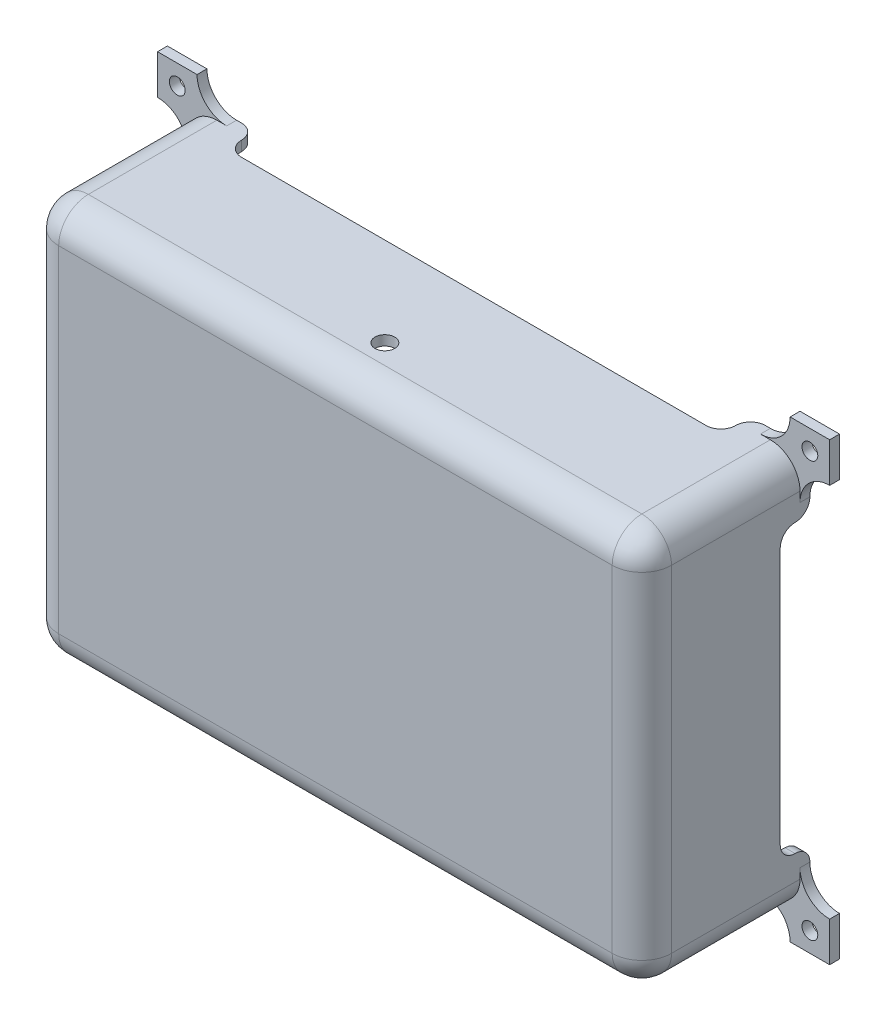
from build123d import *

# Parameters (mm, degrees)
SKETCH2_R           = 4
SKETCH2_W           = 300
SKETCH2_H           = 190
BOSS_EXTRUDE1_DEPTH = 5
SKETCH3_W           = 310
SKETCH3_H           = 200
SKETCH3_W_2         = 300
SKETCH3_H_2         = 190
BOSS_EXTRUDE2_DEPTH = 75
SKETCH4_W           = 310
SKETCH4_H           = 200
BOSS_EXTRUDE3_DEPTH = 5
FILLET2_R           = 15
FILLET3_R           = 15
FILLET4_R           = 15
SKETCH5_R           = 5
CUT_EXTRUDE1_DEPTH  = 5
SKETCH6_W           = 250
SKETCH6_H           = 30
CUT_EXTRUDE2_DEPTH  = 400
SKETCH7_W           = 30
SKETCH7_H           = 145
CUT_EXTRUDE3_DEPTH  = 400
FILLET5_START       = -155
FILLET5_DEPTH       = 5
FILLET5_START_2     = 150
FILLET5_2_DEPTH     = 5
FILLET5_START_3     = -100
FILLET5_3_DEPTH     = 5
FILLET5_START_4     = 95
FILLET5_4_DEPTH     = 5
FILLET5_START_5     = -170
FILLET5_5_DEPTH     = 340
FILLET5_START_6     = -115
FILLET5_6_DEPTH     = 230


with BuildPart() as part:
    # Sketch2 → Boss-Extrude1 (new body)
    with BuildSketch(Plane.XY):
        Polygon((150, -100), (-150, -100), (-150, -115), (-170, -115), (-170, -95), (-155, -95), (-155, 95), (-170, 95), (-170, 115), (-150, 115), (-150, 100), (150, 100), (150, 115), (170, 115), (170, 95), (155, 95), (155, -95), (170, -95), (170, -115), (150, -115), align=None)
        with Locations((-160, 105)):
            Circle(SKETCH2_R, mode=Mode.SUBTRACT)
        with Locations(Location((160, 105, 0), (0, 0, 180))):
            Circle(SKETCH2_R, mode=Mode.SUBTRACT)
        with Locations((160, -105)):
            Circle(SKETCH2_R, mode=Mode.SUBTRACT)
        with Locations(Location((-160, -105, 0), (0, 0, 180))):
            Circle(SKETCH2_R, mode=Mode.SUBTRACT)
        Rectangle(SKETCH2_W, SKETCH2_H, mode=Mode.SUBTRACT)
    extrude(amount=BOSS_EXTRUDE1_DEPTH)

    # Sketch3 → Boss-Extrude2 (add)
    with BuildSketch(Plane.XY.offset(5)):
        Rectangle(SKETCH3_W, SKETCH3_H)
        Rectangle(SKETCH3_W_2, SKETCH3_H_2, mode=Mode.SUBTRACT)
    extrude(amount=BOSS_EXTRUDE2_DEPTH)

    # Sketch4 → Boss-Extrude3 (add)
    with BuildSketch(Plane.XY.offset(80)):
        Rectangle(SKETCH4_W, SKETCH4_H)
    extrude(amount=BOSS_EXTRUDE3_DEPTH)

    # Fillet2
    fillet2_edges = [part.edges().sort_by_distance(p)[0] for p in [
        (-150, 0, 80),
        (0, -95, 80),
        (150, 0, 80),
        (0, 95, 80),
        (150, -95, 40),
        (150, 95, 40),
        (-150, 95, 40),
        (-150, -95, 40),
    ]]
    fillet(fillet2_edges, radius=FILLET2_R)

    # Fillet3
    fillet3_edges = [part.edges().sort_by_distance(p)[0] for p in [
        (-155, -95, 2.5),
        (-150, -100, 2.5),
        (150, -100, 2.5),
        (155, -95, 2.5),
        (155, 95, 2.5),
        (150, 100, 2.5),
        (-155, 95, 2.5),
        (-150, 100, 2.5),
    ]]
    fillet(fillet3_edges, radius=FILLET3_R - 0.0001)  # a hair under: the kernel refuses the full size

    # Fillet4
    fillet4_edges = [part.edges().sort_by_distance(p)[0] for p in [
        (155, -100, 45),
        (155, 100, 45),
        (-155, 0, 85),
        (0, -100, 85),
        (155, 0, 85),
        (0, 100, 85),
        (-155, 100, 45),
        (-155, -100, 45),
    ]]
    fillet(fillet4_edges, radius=FILLET4_R)

    # Sketch5 → Cut-Extrude1 (cut)
    with BuildSketch(Plane(origin=(0, 100, 0), x_dir=(1, 0, 0), z_dir=(0, 1, 0))):
        with Locations(Location((0, -60, 0), (0, 0, 180))):
            Circle(SKETCH5_R)
    extrude(amount=-CUT_EXTRUDE1_DEPTH, mode=Mode.SUBTRACT)

    # Sketch6 → Cut-Extrude2 (cut)
    with BuildSketch(Plane(origin=(0, 100, 0), x_dir=(1, 0, 0), z_dir=(0, 1, 0))):
        Rectangle(SKETCH6_W, SKETCH6_H)
    extrude(amount=-CUT_EXTRUDE2_DEPTH, mode=Mode.SUBTRACT)

    # Sketch7 → Cut-Extrude3 (cut)
    with BuildSketch(Plane(origin=(155, 0, 0), x_dir=(0, 0, -1), z_dir=(1, 0, 0))):
        Rectangle(SKETCH7_W, SKETCH7_H)
    extrude(amount=-CUT_EXTRUDE3_DEPTH, mode=Mode.SUBTRACT)

    # Fillet5: read off the stored shape, not the designer's step
    # Fillet5 outline → Fillet5 (add)
    with BuildSketch(Plane.YZ.offset(FILLET5_START)):
        with BuildLine():
            Line((72.5, 15), (65, 15))
            ThreePointArc((65, 15), (70.303300859, 12.803300859), (72.5, 7.5))
            Line((72.5, 7.5), (72.5, 15))
        make_face()
        with BuildLine():
            Line((-72.5, 15), (-72.5, 7.5))
            ThreePointArc((-72.5, 7.5), (-70.303300859, 12.803300859), (-65, 15))
            Line((-65, 15), (-72.5, 15))
        make_face()
    extrude(amount=FILLET5_DEPTH)

    # Fillet5 2 outline → Fillet5 2 (add)
    with BuildSketch(Plane.YZ.offset(FILLET5_START_2)):
        with BuildLine():
            Line((72.5, 15), (65, 15))
            ThreePointArc((65, 15), (70.303300859, 12.803300859), (72.5, 7.5))
            Line((72.5, 7.5), (72.5, 15))
        make_face()
        with BuildLine():
            Line((-72.5, 15), (-72.5, 7.5))
            ThreePointArc((-72.5, 7.5), (-70.303300859, 12.803300859), (-65, 15))
            Line((-65, 15), (-72.5, 15))
        make_face()
    extrude(amount=FILLET5_2_DEPTH)

    # Fillet5 3 outline → Fillet5 3 (add)
    with BuildSketch(Plane(origin=(0, 0, 0), x_dir=(1, 0, 0), z_dir=(0, 1, 0)).offset(FILLET5_START_3)):
        with BuildLine():
            ThreePointArc((125, -7.5), (122.803300859, -12.803300859), (117.5, -15))
            Line((117.5, -15), (125, -15))
            Line((125, -15), (125, -7.5))
        make_face()
        with BuildLine():
            ThreePointArc((-117.5, -15), (-122.803300859, -12.803300859), (-125, -7.5))
            Line((-125, -7.5), (-125, -15))
            Line((-125, -15), (-117.5, -15))
        make_face()
    extrude(amount=FILLET5_3_DEPTH)

    # Fillet5 4 outline → Fillet5 4 (add)
    with BuildSketch(Plane(origin=(0, 0, 0), x_dir=(1, 0, 0), z_dir=(0, 1, 0)).offset(FILLET5_START_4)):
        with BuildLine():
            ThreePointArc((125, -7.5), (122.803300859, -12.803300859), (117.5, -15))
            Line((117.5, -15), (125, -15))
            Line((125, -15), (125, -7.5))
        make_face()
        with BuildLine():
            ThreePointArc((-117.5, -15), (-122.803300859, -12.803300859), (-125, -7.5))
            Line((-125, -7.5), (-125, -15))
            Line((-125, -15), (-117.5, -15))
        make_face()
    extrude(amount=FILLET5_4_DEPTH)

    # Fillet5 5 outline → Fillet5 5 (cut)
    with BuildSketch(Plane.YZ.offset(FILLET5_START_5)):
        with BuildLine():
            ThreePointArc((80, 0), (74.696699141, 2.196699141), (72.5, 7.5))
            Line((72.5, 7.5), (72.5, 0))
            Line((72.5, 0), (80, 0))
        make_face()
        with BuildLine():
            ThreePointArc((-72.5, 7.5), (-74.696699141, 2.196699141), (-80, 0))
            Line((-80, 0), (-72.5, 0))
            Line((-72.5, 0), (-72.5, 7.5))
        make_face()
    extrude(amount=FILLET5_5_DEPTH, mode=Mode.SUBTRACT)

    # Fillet5 6 outline → Fillet5 6 (cut)
    with BuildSketch(Plane(origin=(0, 0, 0), x_dir=(1, 0, 0), z_dir=(0, 1, 0)).offset(FILLET5_START_6)):
        with BuildLine():
            Line((-125, 0), (-132.5, 0))
            ThreePointArc((-132.5, 0), (-127.196699141, -2.196699141), (-125, -7.5))
            Line((-125, -7.5), (-125, 0))
        make_face()
        with BuildLine():
            Line((125, 0), (125, -7.5))
            ThreePointArc((125, -7.5), (127.196699141, -2.196699141), (132.5, 0))
            Line((132.5, 0), (125, 0))
        make_face()
    extrude(amount=FILLET5_6_DEPTH, mode=Mode.SUBTRACT)


solid = part.part
